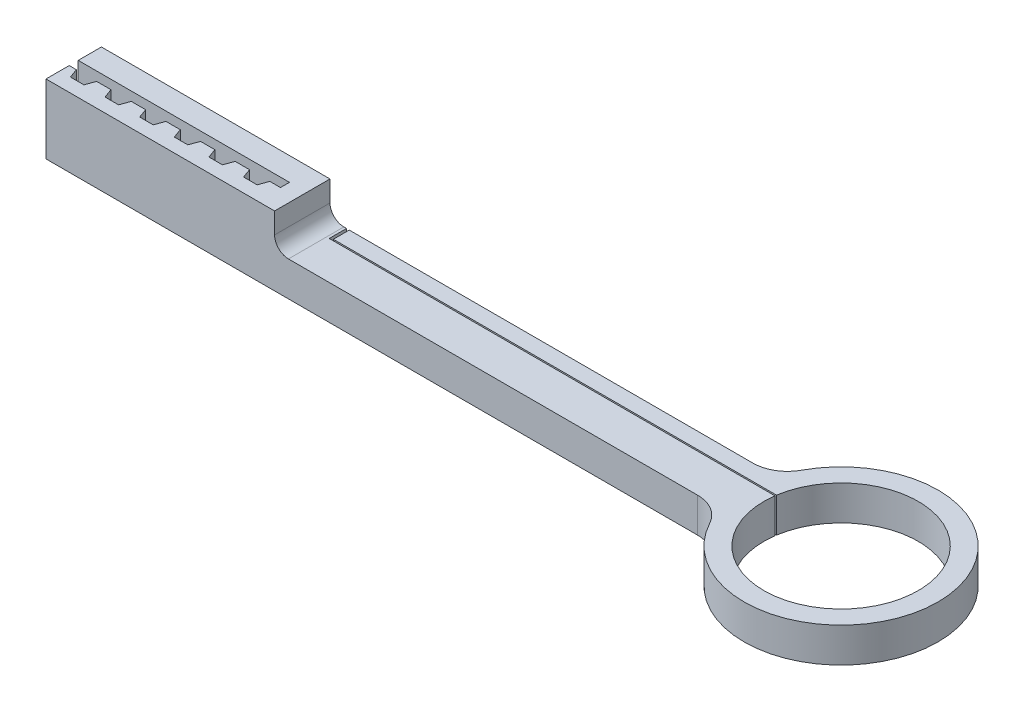
from build123d import *

# Parameters (mm, degrees)
SKETCH_1_R          = 14
SKETCH_1_R_2        = 11.15
RING_DEPTH          = 5
STICK_DEPTH         = 5
SKETCH_3_W          = 33
SKETCH_3_H          = 8
KEY_DEPTH           = 10
FILLET_1_R          = 5
FILLET_5_R          = 2
KEY_HOLE_DEPTH      = 112.914636511
KEY_HOLE_DEPTH_BACK = 112.914636511
CUT_EXTRUDE_2_DEPTH = 113.109927595


with BuildPart() as part:
    # Эскиз1 → ring (new body)
    with BuildSketch(Plane(origin=(0, 0, 0), x_dir=(1, 0, 0), z_dir=(0, 1, 0))):
        Circle(SKETCH_1_R)
        Circle(SKETCH_1_R_2, mode=Mode.SUBTRACT)
    extrude(amount=RING_DEPTH)

    # Эскиз2 → stick (add)
    with BuildSketch(Plane(origin=(0, 0, 0), x_dir=(1, 0, 0), z_dir=(0, 1, 0))):
        with BuildLine():
            Line((-10.781929326, 4), (-110.781929326, 4))
            Line((-110.781929326, 4), (-110.781929326, -4))
            Line((-110.781929326, -4), (-10.781929326, -4))
            ThreePointArc((-10.781929326, -4), (-11.5, 0), (-10.781929326, 4))
        make_face()
    extrude(amount=STICK_DEPTH)

    # Эскиз3 → key (add)
    with BuildSketch(Plane(origin=(0, 0, 0), x_dir=(1, 0, 0), z_dir=(0, 1, 0))):
        with Locations((-94.281929326, 0)):
            Rectangle(SKETCH_3_W, SKETCH_3_H)
    extrude(amount=KEY_DEPTH)

    # Скругление1
    fillet_1_edges = [part.edges().sort_by_distance(p)[0] for p in [
        (-13.416407865, 2.5, 4),
        (-13.416407865, 2.5, -4),
    ]]
    fillet(fillet_1_edges, radius=FILLET_1_R)

    # Скругление5
    fillet_5_edges = [part.edges().sort_by_distance(p)[0] for p in [
        (-77.781929326, 5, 0),
    ]]
    fillet(fillet_5_edges, radius=FILLET_5_R)

    # Эскиз4 → key hole (cut, two sides: drawn at the far end of the back side and taken through both)
    with BuildSketch(Plane(origin=(0, 2.5, 0), x_dir=(1, 0, 0), z_dir=(0, 1, 0)).offset(-KEY_HOLE_DEPTH_BACK)):
        Polygon((-110.781929326, 0.65), (-80.281929326, 0.65), (-80.281929326, -0.65), (-80.781929326, -0.65), (-81.81556951, -0.65), (-82.306929326, -2), (-84.256929326, -2), (-84.748289143, -0.65), (-85.781929326, -0.65), (-86.81556951, -0.65), (-87.306929326, -2), (-89.256929326, -2), (-89.748289143, -0.65), (-90.781929326, -0.65), (-91.81556951, -0.65), (-92.306929326, -2), (-94.256929326, -2), (-94.748289143, -0.65), (-95.781929326, -0.65), (-96.81556951, -0.65), (-97.306929326, -2), (-99.256929326, -2), (-99.748289143, -0.65), (-100.781929326, -0.65), (-101.81556951, -0.65), (-102.306929326, -2), (-104.256929326, -2), (-104.748289143, -0.65), (-105.781929326, -0.65), (-106.81556951, -0.65), (-107.306929326, -2), (-109.256929326, -2), (-109.748289143, -0.65), (-110.781929326, -0.65), align=None)
    extrude(amount=KEY_HOLE_DEPTH + KEY_HOLE_DEPTH_BACK, mode=Mode.SUBTRACT)

    # Эскиз5 → Вытянуть2 (cut, through all)
    with BuildSketch(Plane.XZ):
        Polygon((-75.4, -4), (-75.4, -1.5), (0, -1.5), (0, -1.7), (-75, -1.7), (-75, -4), align=None)
    extrude(amount=-CUT_EXTRUDE_2_DEPTH, mode=Mode.SUBTRACT)


solid = part.part
